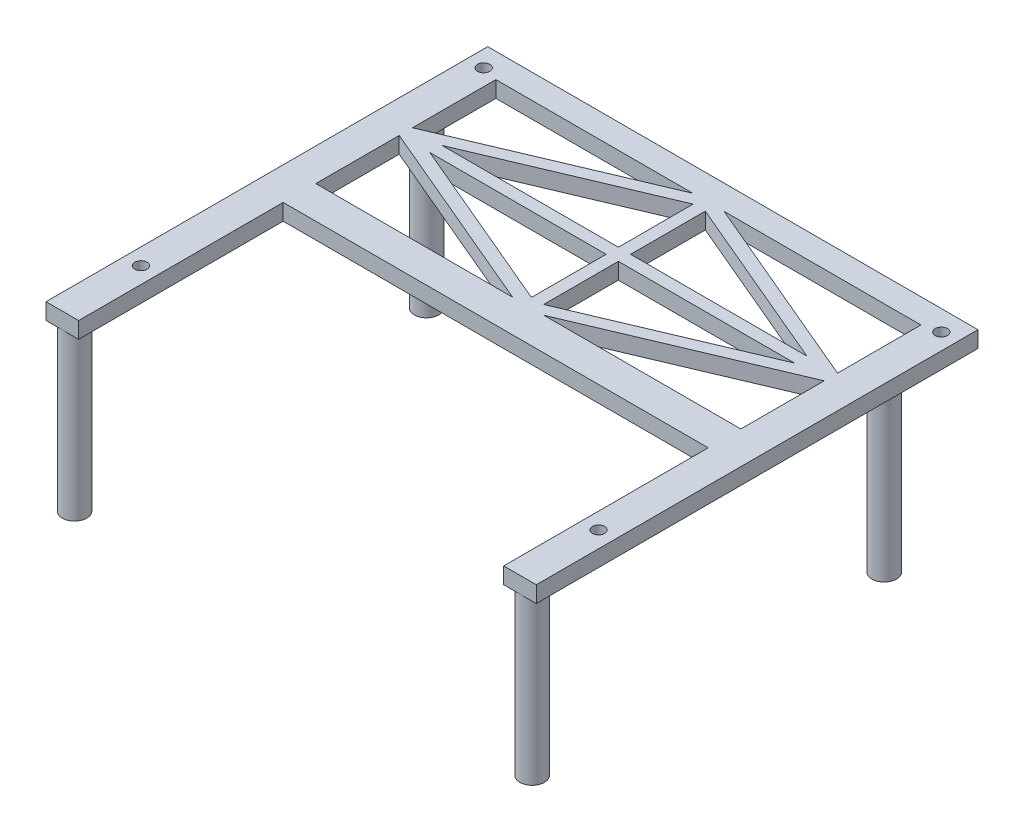
from build123d import *

# Parameters (mm, degrees)
SKETCH_1_R          = 1.5
EXTRUDE_1_DEPTH     = 20
EXTRUDE_1_2_DEPTH   = 20
EXTRUDE_1_3_DEPTH   = 20
EXTRUDE_1_4_DEPTH   = 20
EXTRUDE_2_DEPTH     = 2
SKETCH_4_R          = 0.75
CUT_EXTRUDE_1_DEPTH = 2
SKETCH_5_W          = 52.13
SKETCH_5_H          = 3
EXTRUDE_3_DEPTH     = 2
EXTRUDE_START       = -2
EXTRUDE_3_2_DEPTH   = 2


# Read off the part's stored shape, not the designer's step: 拉伸-薄壁3
with BuildPart() as part:
    # 草图1 → 凸台-拉伸1 (new body)
    with BuildSketch(Plane(origin=(0, 0, 0), x_dir=(1, 0, 0), z_dir=(0, 1, 0))):
        with Locations(Location((0, 0, 0), (0, 0, 270))):
            Circle(SKETCH_1_R)
    extrude(amount=EXTRUDE_1_DEPTH)



with BuildPart() as body_2:
    # 草图1 → Extrude 1 2 (new body)
    with BuildSketch(Plane(origin=(0, 0, 0), x_dir=(1, 0, 0), z_dir=(0, 1, 0))):
        with Locations(Location((0, 43.18, 0), (0, 0, 270))):
            Circle(SKETCH_1_R)
    extrude(amount=EXTRUDE_1_2_DEPTH)


with BuildPart() as body_3:
    # 草图1 → Extrude 1 3 (new body)
    with BuildSketch(Plane(origin=(0, 0, 0), x_dir=(1, 0, 0), z_dir=(0, 1, 0))):
        with Locations(Location((56.13, 43.18, 0), (0, 0, 270))):
            Circle(SKETCH_1_R)
    extrude(amount=EXTRUDE_1_3_DEPTH)


with BuildPart() as body_4:
    # 草图1 → Extrude 1 4 (new body)
    with BuildSketch(Plane(origin=(0, 0, 0), x_dir=(1, 0, 0), z_dir=(0, 1, 0))):
        with Locations(Location((56.13, 0, 0), (0, 0, 270))):
            Circle(SKETCH_1_R)
    extrude(amount=EXTRUDE_1_4_DEPTH)


with BuildPart() as part_1:
    add(part.part)

    add(body_2.part)  # 凸台-拉伸2 merges body 2
    # 草图2 → 凸台-拉伸2 (add)
    with BuildSketch(Plane(origin=(0, 20, 0), x_dir=(1, 0, 0), z_dir=(0, 1, 0))):
        Polygon((-2, 52.68), (-2, -1.5), (2, -1.5), (2, 23.59), (54.13, 23.59), (54.13, -1.5), (58.13, -1.5), (58.13, 52.68), (54.13, 52.68), (54.13, 27.59), (2, 27.59), (2, 52.68), align=None)
    extrude(amount=EXTRUDE_2_DEPTH)

    # 草图4 → 切除-拉伸1 (cut)
    with BuildSketch(Plane(origin=(0, 22, 0), x_dir=(1, 0, 0), z_dir=(0, 1, 0))):
        with Locations(Location((0, 50.18, 0), (0, 0, 270))):
            Circle(SKETCH_4_R)
        with Locations(Location((0, 8.143, 0), (0, 0, 270))):
            Circle(SKETCH_4_R)
        with Locations(Location((56.13, 8.143, 0), (0, 0, 270))):
            Circle(SKETCH_4_R)
        with Locations(Location((56.13, 50.18, 0), (0, 0, 270))):
            Circle(SKETCH_4_R)
    extrude(amount=-CUT_EXTRUDE_1_DEPTH, mode=Mode.SUBTRACT)

    # 草图5 → Extrude 3 (add)
    with BuildSketch(Plane.XZ.offset(-20)):
        with Locations((28.065, -51.18)):
            Rectangle(SKETCH_5_W, SKETCH_5_H)
    extrude(amount=-EXTRUDE_3_DEPTH)

    # Extrude 3 2 outline → Extrude 3 2 (add)
    with BuildSketch(Plane.XZ.offset(-20).offset(EXTRUDE_START)):
        Polygon((26.142732706, -27.59), (2, -37.820442461), (2, -39.449557539), (26.142732706, -49.68), (29.987267294, -49.68), (54.13, -39.449557539), (54.13, -37.820442461), (29.987267294, -27.59), align=None)
        Polygon((27.315, -48.547631219), (5.692185809, -39.385), (27.315, -39.385), align=None, mode=Mode.SUBTRACT)
        Polygon((28.815, -39.385), (50.437814191, -39.385), (28.815, -48.547631219), align=None, mode=Mode.SUBTRACT)
        Polygon((27.315, -37.885), (5.692185809, -37.885), (27.315, -28.722368781), align=None, mode=Mode.SUBTRACT)
        Polygon((28.815, -37.885), (28.815, -28.722368781), (50.437814191, -37.885), align=None, mode=Mode.SUBTRACT)
    extrude(amount=EXTRUDE_3_2_DEPTH)


solid = Compound([body_3.part, body_4.part, part_1.part])
